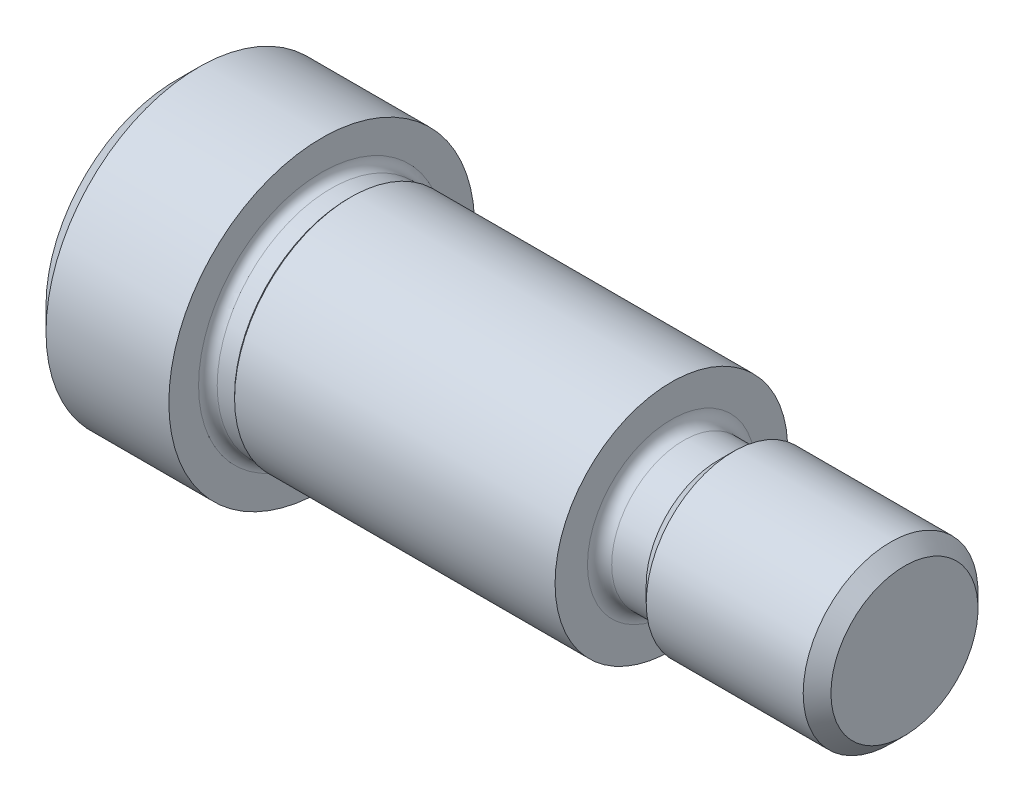
from build123d import *

# Parameters (mm, degrees)
HEX_2_DEPTH = 9.525


# Read off the part's stored shape, not the designer's step: ThreadSchematic
with BuildPart() as part:
    # ThreadSchematic outline → ThreadSchematic (revolve)
    with BuildSketch(Plane.YX):
        with BuildLine():
            Line((0, 79.375), (0, 0))
            Line((0, 0), (14.1732, 0))
            Line((14.1732, 0), (16.6624, 2.4892))
            Line((16.6624, 2.4892), (16.6624, 15.875))
            Line((16.6624, 15.875), (13.4239, 15.875))
            ThreePointArc((13.4239, 15.875), (12.70547951, 16.17257951), (12.4079, 16.891))
            Line((12.4079, 16.891), (12.4079, 18.7833))
            Line((12.4079, 18.7833), (12.6746, 19.05))
            Line((12.6746, 19.05), (12.6746, 53.975))
            Line((12.6746, 53.975), (9.144, 53.975))
            ThreePointArc((9.144, 53.975), (8.210053363, 54.361853363), (7.8232, 55.2958))
            Line((7.8232, 55.2958), (7.8232, 59.055))
            Line((7.8232, 59.055), (9.525, 60.7568))
            Line((9.525, 60.7568), (9.525, 77.86243))
            Line((9.525, 77.86243), (8.01243, 79.375))
            Line((8.01243, 79.375), (0, 79.375))
        make_face()
    revolve(axis=Axis((0, 0, 0), (1, 0, 0)))

    # Sketch2 → PreBroach (revolve, cut)
    with BuildSketch(Plane.XY, mode=Mode.PRIVATE) as prebroach_sk:
        Polygon((0, 6.35), (9.525, 6.35), (13.191174209, 0), (0, 0), align=None)
    revolve(prebroach_sk.sketch.rotate(Axis((0, 0, 0), (1, 0, 0)), 90), axis=Axis((0, 0, 0), (1, 0, 0)), mode=Mode.SUBTRACT)

    # Sketch3 → Hex 2 (cut)
    with BuildSketch(Plane.ZY):
        Polygon((-6.35, -3.666174209), (-6.35, 3.666174209), (0, 7.332348419), (6.35, 3.666174209), (6.35, -3.666174209), (0, -7.332348419), align=None)
    extrude(amount=-HEX_2_DEPTH, mode=Mode.SUBTRACT)


solid = part.part
